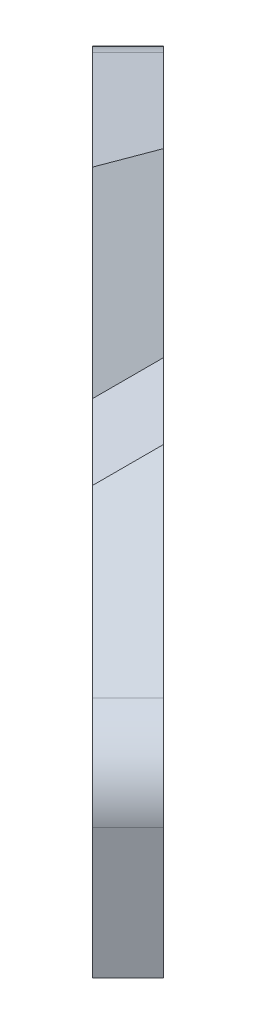
from build123d import *

# Parameters (mm, degrees)
EXTRUDE_1_DEPTH     = 134.35
SKETCH_2_OUTSIDE_W  = 174.82
SKETCH_2_OUTSIDE_H  = 174.82
CUT_EXTRUDE_1_DEPTH = 193.353437713
CUT_EXTRUDE_START   = -10
CUT_EXTRUDE_2_DEPTH = 10
EXTRUDE_2_DEPTH     = 22.5


# Read off the part's stored shape, not the designer's step: Вырез-Вытянуть2
with BuildPart() as part:
    # Эскиз1 → Бобышка-Вытянуть1 (new body)
    with BuildSketch(Plane.XY):
        Polygon((0, 0), (0, 30), (39.675, 30), (59.675, 10), (74.675, 10), (94.675, 30), (134.35, 30), (134.35, 0), align=None)
    extrude(amount=EXTRUDE_1_DEPTH)

    # Эскиз2 outside → Вырез-Вытянуть1 (cut, through all)
    with BuildSketch(Plane.XZ):
        with Locations((67.175, 67.175)):
            Rectangle(SKETCH_2_OUTSIDE_W, SKETCH_2_OUTSIDE_H)
        Polygon((127.278932188, 134.35), (0, 7.071067812), (7.071067812, 0), (134.35, 127.278932188), align=None, mode=Mode.SUBTRACT)
    extrude(amount=-CUT_EXTRUDE_1_DEPTH, mode=Mode.SUBTRACT)

    # Вырез-Вытянуть2 outline → Вырез-Вытянуть2 (cut)
    with BuildSketch(Plane(origin=(-3.535533906, 0, 3.535533906), x_dir=(0.7071067811865475, 0, 0.7071067811865477), z_dir=(-0.7071067811865477, 0, 0.7071067811865475)).offset(CUT_EXTRUDE_START)):
        with BuildLine():
            Line((5, 30), (5, 3.483288217))
            ThreePointArc((5, 3.483288217), (8.102307967, 12.618107552), (16.125989905, 17.974390514))
            Line((16.125989905, 17.974390514), (61.108923087, 30))
            Line((61.108923087, 30), (5, 30))
        make_face()
        with BuildLine():
            Line((184.999592105, 30), (128.634264977, 30))
            Line((128.634264977, 30), (128.820557467, 29.950423647))
            Line((128.820557467, 29.950423647), (173.857147448, 17.965239064))
            ThreePointArc((173.857147448, 17.965239064), (181.89209668, 12.611319604), (184.999592105, 3.469747807))
            Line((184.999592105, 3.469747807), (184.999592105, 30))
        make_face()
    extrude(amount=CUT_EXTRUDE_2_DEPTH, mode=Mode.SUBTRACT)

    # Эскиз5 → Бобышка-Вытянуть2 (add)
    with BuildSketch(Plane.XZ):
        Polygon((134.35, 127.278932188), (127.278932188, 134.35), (0, 7.071067812), (7.071067812, 0), align=None)
    extrude(amount=EXTRUDE_2_DEPTH)


solid = part.part
